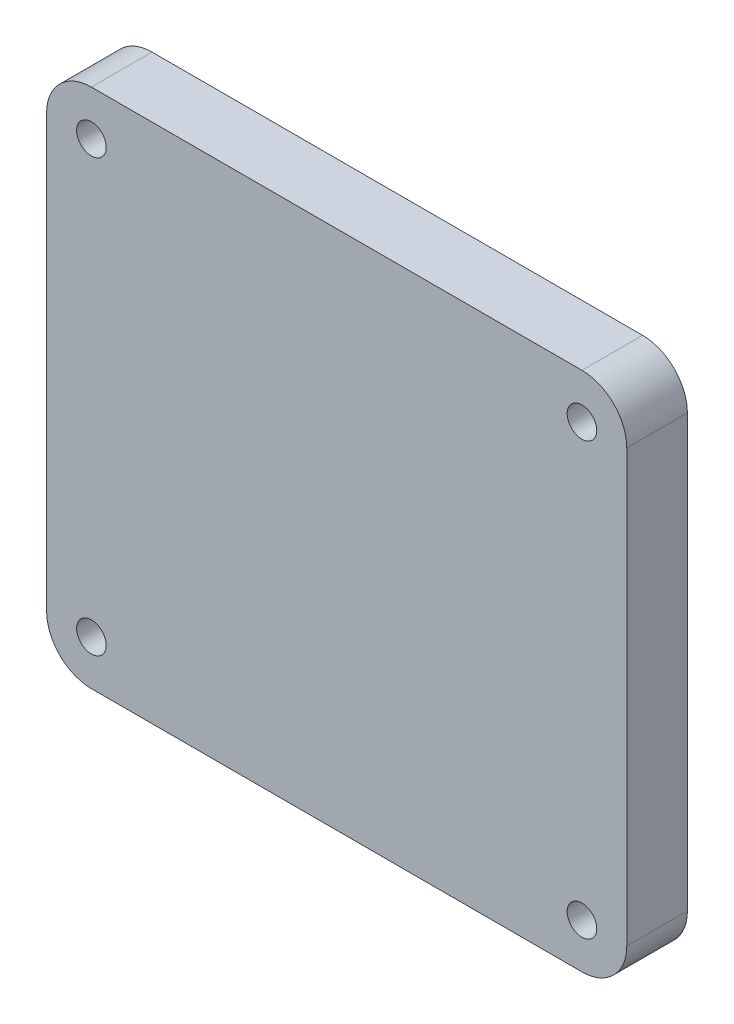
from build123d import *

# Parameters (mm, degrees)
BOSS_EXTRUDE2_START     = -1.618999
SKETCH1_W               = 50.400855702
SKETCH1_H               = 1.5
SKETCH1_W_2             = 1.5
SKETCH1_H_2             = 43.400852302
BOSS_EXTRUDE2_DEPTH     = 5.668998934
SKETCH1_5_R             = 1.74999934
BOSS_EXTRUDE3_DEPTH     = 4.049997769
BOSS_EXTRUDE4_START     = 4.049997821
BOSS_EXTRUDE4_OUTLINE_R = 1.74999934
BOSS_EXTRUDE4_DEPTH     = 1.499999948


# Read off the part's stored shape, not the designer's step: Boss-Extrude4
with BuildPart() as part:
    # Sketch1 → Boss-Extrude2 (new body)
    with BuildSketch(Plane.XY.offset(BOSS_EXTRUDE2_START)):
        with BuildLine():
            Line((7.299572149, 59.8), (3.499574174, 59.8))
            ThreePointArc((3.499574174, 59.8), (-0.247791806, 58.247791067), (-1.8, 54.500424782))
            Line((-1.8, 54.500424782), (-1.8, 50.700426151))
            Line((-1.8, 50.700426151), (-0.3, 50.700426151))
            Line((-0.3, 50.700426151), (-0.3, 54.500425826))
            ThreePointArc((-0.3, 54.500425826), (0.812868735, 57.187131265), (3.499574174, 58.3))
            Line((3.499574174, 58.3), (7.299572149, 58.3))
            Line((7.299572149, 58.3), (7.299572149, 59.8))
        make_face()
        with Locations((32.5, 59.05)):
            Rectangle(SKETCH1_W, SKETCH1_H)
        with BuildLine():
            ThreePointArc((61.500425826, 59.799997355), (65.247788792, 58.247788792), (66.8, 54.500425826))
            Line((66.8, 54.500425826), (66.8, 50.700426151))
            Line((66.8, 50.700426151), (65.3, 50.700426151))
            Line((65.3, 50.700426151), (65.3, 54.500425826))
            ThreePointArc((65.3, 54.500425826), (64.18713049, 57.18713049), (61.500425826, 58.3))
            Line((61.500425826, 58.3), (57.700427851, 58.3))
            Line((57.700427851, 58.3), (57.700427851, 59.8))
            Line((57.700427851, 59.8), (61.500425826, 59.799997355))
        make_face()
        with Locations((66.05, 29)):
            Rectangle(SKETCH1_W_2, SKETCH1_H_2)
        with BuildLine():
            Line((57.700427851, -1.8), (61.500425826, -1.8))
            ThreePointArc((61.500425826, -1.8), (65.247791806, -0.247791067), (66.8, 3.499575218))
            Line((66.8, 3.499575218), (66.8, 7.299573849))
            Line((66.8, 7.299573849), (65.3, 7.299573849))
            Line((65.3, 7.299573849), (65.3, 3.499574174))
            ThreePointArc((65.3, 3.499574174), (64.187131265, 0.812868735), (61.500425826, -0.3))
            Line((61.500425826, -0.3), (57.700427851, -0.3))
            Line((57.700427851, -0.3), (57.700427851, -1.8))
        make_face()
        with Locations((32.5, -1.05)):
            Rectangle(SKETCH1_W, SKETCH1_H)
        with Locations((-1.05, 29)):
            Rectangle(SKETCH1_W_2, SKETCH1_H_2)
        with BuildLine():
            ThreePointArc((3.499576262, -1.800002645), (-0.247793343, -0.24779482), (-1.8, 3.499574174))
            Line((-1.8, 3.499574174), (-1.8, 7.299573849))
            Line((-1.8, 7.299573849), (-0.3, 7.299573849))
            Line((-0.3, 7.299573849), (-0.3, 3.499574174))
            ThreePointArc((-0.3, 3.499574174), (0.812867961, 0.812867961), (3.499574174, -0.3))
            Line((3.499574174, -0.3), (7.299572149, -0.3))
            Line((7.299572149, -0.3), (7.299572149, -1.8))
            Line((7.299572149, -1.8), (3.499576262, -1.800002645))
        make_face()
    extrude(amount=BOSS_EXTRUDE2_DEPTH)

    # Sketch1<5> → Boss-Extrude3 (add)
    # profile 1 of 4: a face of its own
    with BuildSketch(Plane.XY):
        with BuildLine():
            Line((7.299572149, 3.50000232), (7.299572149, -0.3))
            Line((7.299572149, -0.3), (3.499574174, -0.3))
            ThreePointArc((3.499574174, -0.3), (0.812867961, 0.812867961), (-0.3, 3.499574174))
            Line((-0.3, 3.499574174), (-0.3, 7.299573849))
            Line((-0.3, 7.299573849), (3.50000062, 7.299573849))
            ThreePointArc((3.50000062, 7.299573849), (6.186702813, 6.186704015), (7.299572149, 3.50000232))
        make_face()
        with Locations((3.499568884, 3.499568884)):
            Circle(SKETCH1_5_R, mode=Mode.SUBTRACT)
    # profile 2 of 4: a face of its own
    with BuildSketch(Plane.XY):
        with BuildLine():
            Line((7.299572149, 58.3), (3.499574174, 58.3))
            ThreePointArc((3.499574174, 58.3), (0.812868735, 57.187131265), (-0.3, 54.500425826))
            Line((-0.3, 54.500425826), (-0.3, 50.700426151))
            Line((-0.3, 50.700426151), (3.50000062, 50.700426151))
            ThreePointArc((3.50000062, 50.700426151), (6.186703414, 51.813294886), (7.299572149, 54.49999768))
            Line((7.299572149, 54.49999768), (7.299572149, 58.3))
        make_face()
        with Locations((3.499571529, 54.500428471)):
            Circle(SKETCH1_5_R, mode=Mode.SUBTRACT)
    # profile 3 of 4: a face of its own
    with BuildSketch(Plane.XY):
        with BuildLine():
            ThreePointArc((61.500425826, 58.3), (64.18713049, 57.18713049), (65.3, 54.500425826))
            Line((65.3, 54.500425826), (65.3, 50.700426151))
            Line((65.3, 50.700426151), (61.49999938, 50.700426151))
            ThreePointArc((61.49999938, 50.700426151), (58.813296614, 51.813295049), (57.700427851, 54.49999768))
            Line((57.700427851, 54.49999768), (57.700427851, 58.3))
            Line((57.700427851, 58.3), (61.500425826, 58.3))
        make_face()
        with Locations((61.500425826, 54.500425826)):
            Circle(SKETCH1_5_R, mode=Mode.SUBTRACT)
    # profile 4 of 4: a face of its own
    with BuildSketch(Plane.XY):
        with BuildLine():
            Line((57.700427851, -0.3), (61.500425826, -0.3))
            ThreePointArc((61.500425826, -0.3), (64.187131265, 0.812868735), (65.3, 3.499574174))
            Line((65.3, 3.499574174), (65.3, 7.299573849))
            Line((65.3, 7.299573849), (61.49999938, 7.299573849))
            ThreePointArc((61.49999938, 7.299573849), (58.813297215, 6.186703852), (57.700427851, 3.50000232))
            Line((57.700427851, 3.50000232), (57.700427851, -0.3))
        make_face()
        with Locations((61.500428471, 3.499571529)):
            Circle(SKETCH1_5_R, mode=Mode.SUBTRACT)
    extrude(amount=BOSS_EXTRUDE3_DEPTH)

    # Boss-Extrude4 outline → Boss-Extrude4 (add)
    with BuildSketch(Plane.XY.offset(BOSS_EXTRUDE4_START)):
        with BuildLine():
            ThreePointArc((-1.800001322, 3.499574174), (-0.247792408, -0.247793885), (3.499576262, -1.800001322))
            Line((3.499576262, -1.800001322), (61.500425826, -1.8))
            ThreePointArc((61.500425826, -1.8), (65.247791806, -0.247791067), (66.8, 3.499575218))
            Line((66.8, 3.499575218), (66.799998678, 54.500425826))
            ThreePointArc((66.799998678, 54.500425826), (65.247789727, 58.247789727), (61.500425826, 59.799998678))
            Line((61.500425826, 59.799998678), (3.499574174, 59.8))
            ThreePointArc((3.499574174, 59.8), (-0.247791806, 58.247791067), (-1.8, 54.500424782))
            Line((-1.8, 54.500424782), (-1.800001322, 3.499574174))
        make_face()
        with Locations((3.499568884, 3.499568884)):
            Circle(BOSS_EXTRUDE4_OUTLINE_R, mode=Mode.SUBTRACT)
        with Locations((61.500428471, 3.499571529)):
            Circle(BOSS_EXTRUDE4_OUTLINE_R, mode=Mode.SUBTRACT)
        with Locations((3.499571529, 54.500428471)):
            Circle(BOSS_EXTRUDE4_OUTLINE_R, mode=Mode.SUBTRACT)
        with Locations((61.500425826, 54.500425826)):
            Circle(BOSS_EXTRUDE4_OUTLINE_R, mode=Mode.SUBTRACT)
    extrude(amount=BOSS_EXTRUDE4_DEPTH)


solid = part.part
